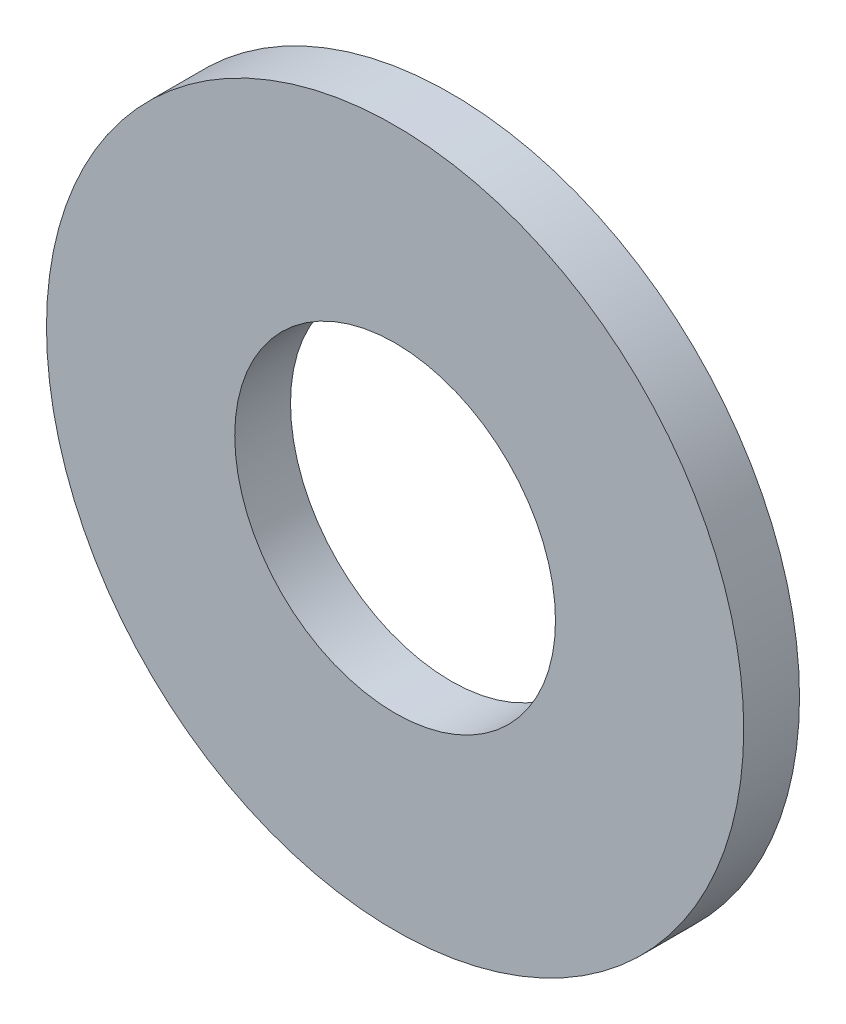
from build123d import *

# Parameters (mm, degrees)
SKETCH1_R      = 6.35
SKETCH1_R_2    = 2.921
EXTRUDE1_DEPTH = 1.016


with BuildPart() as part:
    # Sketch1 → Extrude1 (new body)
    with BuildSketch(Plane.XY):
        Circle(SKETCH1_R)
        Circle(SKETCH1_R_2, mode=Mode.SUBTRACT)
    extrude(amount=-EXTRUDE1_DEPTH)


solid = part.part
